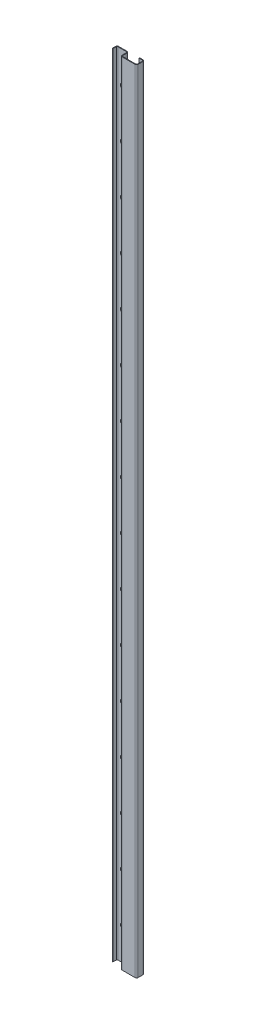
from build123d import *

# Parameters (mm, degrees)
SKETCH1_W                    = 36
SKETCH1_H                    = 2480
BASE_FLANGE1_DEPTH           = 2
EDGE_FLANGE1_STRIP_W         = 13
EDGE_FLANGE1_STRIP_H         = 2
EDGE_FLANGE1_STRIP_CUT_DEPTH = 2480
EDGE_FLANGE1_DEPTH           = 2480
EDGE_FLANGE2_STRIP_W         = 13
EDGE_FLANGE2_STRIP_H         = 2
EDGE_FLANGE2_STRIP_CUT_DEPTH = 2480
EDGE_FLANGE2_DEPTH           = 2480
EDGE_FLANGE3_STRIP_W         = 13
EDGE_FLANGE3_STRIP_H         = 2
EDGE_FLANGE3_STRIP_CUT_DEPTH = 2480
EDGE_FLANGE3_DEPTH           = 2480
EDGE_FLANGE4_STRIP_W         = 13
EDGE_FLANGE4_STRIP_H         = 2
EDGE_FLANGE4_STRIP_CUT_DEPTH = 2480
EDGE_FLANGE4_DEPTH           = 2480
EDGE_FLANGE5_STRIP_W         = 13
EDGE_FLANGE5_STRIP_H         = 2
EDGE_FLANGE5_STRIP_CUT_DEPTH = 2480
EDGE_FLANGE5_DEPTH           = 2480
SKETCH21_R                   = 6
CUT_EXTRUDE1_DEPTH           = 10
LPATTERN1_COUNT              = 16
LPATTERN1_PITCH              = 152


# Sheet-metal steps are written as plain solids
with BuildPart() as part:
    # Sketch1 → Base-Flange1 (new body)
    with BuildSketch(Plane.XY):
        Rectangle(SKETCH1_W, SKETCH1_H)
    extrude(amount=-BASE_FLANGE1_DEPTH)

    # Edge-Flange1 strip (across the edge) → Edge-Flange1 strip cut (cut)
    with BuildSketch(Plane(origin=(-18, 1240, 0), x_dir=(1, 0, 0), z_dir=(0, -1, 0))):
        with Locations((-2, -1)):
            Rectangle(EDGE_FLANGE1_STRIP_W, EDGE_FLANGE1_STRIP_H)
    extrude(amount=EDGE_FLANGE1_STRIP_CUT_DEPTH, mode=Mode.SUBTRACT)

    # Edge-Flange1 section (across the edge) → Edge-Flange1 (add)
    with BuildSketch(Plane(origin=(-18, 1240, 0), x_dir=(1, 0, 0), z_dir=(0, -1, 0))):
        with BuildLine():
            Line((0, 2.5), (0, 13))
            Line((0, 13), (2, 13))
            Line((2, 13), (2, 2.5))
            ThreePointArc((2, 2.5), (2.732233047, 0.732233047), (4.5, 0))
            Line((4.5, 0), (4.5, -2))
            ThreePointArc((4.5, -2), (1.318019485, -0.681980515), (0, 2.5))
        make_face()
    extrude(amount=EDGE_FLANGE1_DEPTH)

    # Edge-Flange2 strip (across the edge) → Edge-Flange2 strip cut (cut)
    with BuildSketch(Plane(origin=(18, -1240, 0), x_dir=(-1, 0, 0), z_dir=(0, 1, 0))):
        with Locations((-2, -1)):
            Rectangle(EDGE_FLANGE2_STRIP_W, EDGE_FLANGE2_STRIP_H)
    extrude(amount=EDGE_FLANGE2_STRIP_CUT_DEPTH, mode=Mode.SUBTRACT)

    # Edge-Flange2 section (across the edge) → Edge-Flange2 (add)
    with BuildSketch(Plane(origin=(18, -1240, 0), x_dir=(-1, 0, 0), z_dir=(0, 1, 0))):
        with BuildLine():
            Line((0, 2.5), (0, 21))
            Line((0, 21), (2, 21))
            Line((2, 21), (2, 2.5))
            ThreePointArc((2, 2.5), (2.732233047, 0.732233047), (4.5, 0))
            Line((4.5, 0), (4.5, -2))
            ThreePointArc((4.5, -2), (1.318019485, -0.681980515), (0, 2.5))
        make_face()
    extrude(amount=EDGE_FLANGE2_DEPTH)

    # Edge-Flange3 strip (across the edge) → Edge-Flange3 strip cut (cut)
    with BuildSketch(Plane(origin=(18, 1240, 21), x_dir=(0, 0, -1), z_dir=(0, -1, 0))):
        with Locations((-2, -1)):
            Rectangle(EDGE_FLANGE3_STRIP_W, EDGE_FLANGE3_STRIP_H)
    extrude(amount=EDGE_FLANGE3_STRIP_CUT_DEPTH, mode=Mode.SUBTRACT)

    # Edge-Flange3 section (across the edge) → Edge-Flange3 (add)
    with BuildSketch(Plane(origin=(18, 1240, 21), x_dir=(0, 0, -1), z_dir=(0, -1, 0))):
        with BuildLine():
            Line((0, 2.5), (0, 48))
            Line((0, 48), (2, 48))
            Line((2, 48), (2, 2.5))
            ThreePointArc((2, 2.5), (2.732233047, 0.732233047), (4.5, 0))
            Line((4.5, 0), (4.5, -2))
            ThreePointArc((4.5, -2), (1.318019485, -0.681980515), (0, 2.5))
        make_face()
    extrude(amount=EDGE_FLANGE3_DEPTH)

    # Edge-Flange4 strip (across the edge) → Edge-Flange4 strip cut (cut)
    with BuildSketch(Plane(origin=(66, 1240, 19), x_dir=(-1, 0, 0), z_dir=(0, -1, 0))):
        with Locations((-2, -1)):
            Rectangle(EDGE_FLANGE4_STRIP_W, EDGE_FLANGE4_STRIP_H)
    extrude(amount=EDGE_FLANGE4_STRIP_CUT_DEPTH, mode=Mode.SUBTRACT)

    # Edge-Flange4 section (across the edge) → Edge-Flange4 (add)
    with BuildSketch(Plane(origin=(66, 1240, 19), x_dir=(-1, 0, 0), z_dir=(0, -1, 0))):
        with BuildLine():
            Line((0, 2.5), (0, 23))
            Line((0, 23), (2, 23))
            Line((2, 23), (2, 2.5))
            ThreePointArc((2, 2.5), (2.732233047, 0.732233047), (4.5, 0))
            Line((4.5, 0), (4.5, -2))
            ThreePointArc((4.5, -2), (1.318019485, -0.681980515), (0, 2.5))
        make_face()
    extrude(amount=EDGE_FLANGE4_DEPTH)

    # Edge-Flange5 strip (across the edge) → Edge-Flange5 strip cut (cut)
    with BuildSketch(Plane(origin=(64, 1240, -4), x_dir=(0, 0, 1), z_dir=(0, -1, 0))):
        with Locations((-2, -1)):
            Rectangle(EDGE_FLANGE5_STRIP_W, EDGE_FLANGE5_STRIP_H)
    extrude(amount=EDGE_FLANGE5_STRIP_CUT_DEPTH, mode=Mode.SUBTRACT)

    # Edge-Flange5 section (across the edge) → Edge-Flange5 (add)
    with BuildSketch(Plane(origin=(64, 1240, -4), x_dir=(0, 0, 1), z_dir=(0, -1, 0))):
        with BuildLine():
            Line((0, 2.5), (0, 13))
            Line((0, 13), (2, 13))
            Line((2, 13), (2, 2.5))
            ThreePointArc((2, 2.5), (2.732233047, 0.732233047), (4.5, 0))
            Line((4.5, 0), (4.5, -2))
            ThreePointArc((4.5, -2), (1.318019485, -0.681980515), (0, 2.5))
        make_face()
    extrude(amount=EDGE_FLANGE5_DEPTH)

    # Sketch21 → Cut-Extrude1 (cut)
    with BuildSketch(Plane.XY):
        with Locations((0, 1140)):
            Circle(SKETCH21_R)
    cut_extrude1 = extrude(amount=-CUT_EXTRUDE1_DEPTH, mode=Mode.SUBTRACT)

    # LPattern1: Cut-Extrude1 ×16
    with Locations(*[(0, -i * LPATTERN1_PITCH, 0) for i in range(1, LPATTERN1_COUNT)]):
        add(cut_extrude1, mode=Mode.SUBTRACT)


solid = part.part
